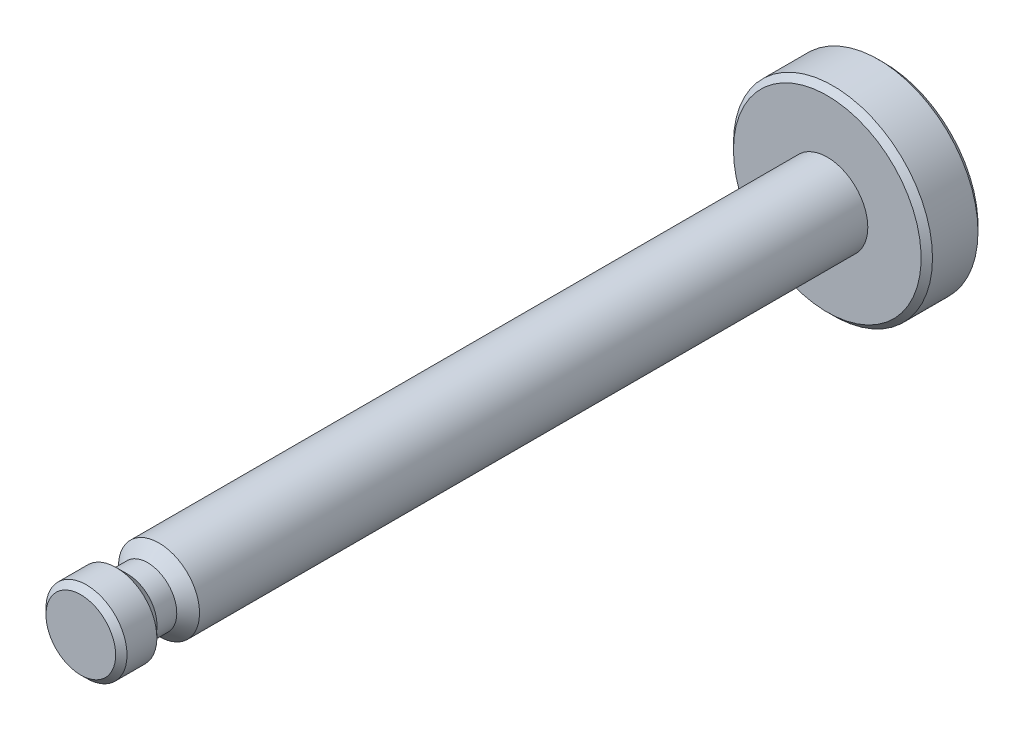
from build123d import *

# Parameters (mm, degrees)
SKETCH2_R   = 1.425
SHAFT_DEPTH = 26.25
SKETCH3_R   = 3.5
HEAD_DEPTH  = 2
DEBURS_SIZE = 0.2


with BuildPart() as part:
    # Sketch2 → Shaft (new body)
    with BuildSketch(Plane.XY):
        Circle(SKETCH2_R)
    extrude(amount=SHAFT_DEPTH)

    # Sketch3 → Head (add)
    with BuildSketch(Plane(origin=(0, 0, 0), x_dir=(-1, 0, 0), z_dir=(0, 0, -1))):
        Circle(SKETCH3_R)
    extrude(amount=HEAD_DEPTH)

    # Sketch4 → e-Clip Notch (revolve, cut)
    with BuildSketch(Plane(origin=(0, 0, 0), x_dir=(0, 0, -1), z_dir=(1, 0, 0))):
        Polygon((-25, 1.425), (-23.5, 1.425), (-23.9, 1.025), (-24.6, 1.025), align=None)
    revolve(axis=Axis((0, 0, 0), (0, 0, 1)), mode=Mode.SUBTRACT)

    # Deburs
    deburs_edges = [part.edges().sort_by_distance(p)[0] for p in [
        (-1.425, 0, 26.25),
        (3.5, 0, 0),
        (3.5, 0, -2),
    ]]
    chamfer(deburs_edges, length=DEBURS_SIZE)


solid = part.part
